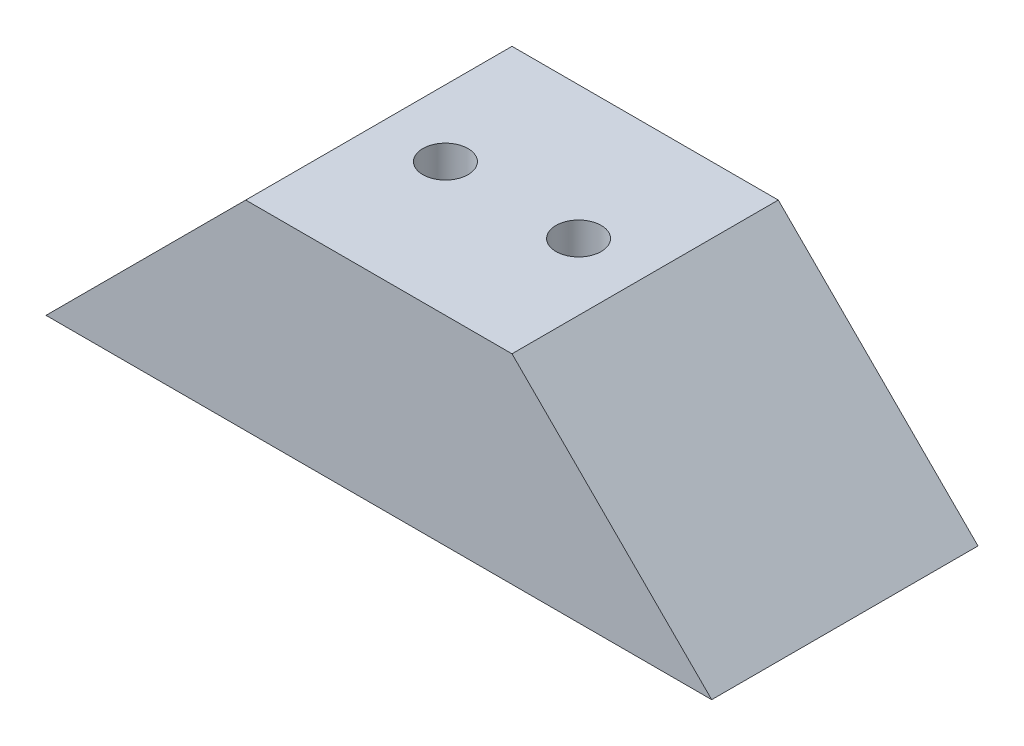
from build123d import *

# Parameters (mm, degrees)
EXTRUDE_1_DEPTH     = 20
SKETCH_2_R          = 1.7
CUT_EXTRUDE_1_DEPTH = 36.355339059


with BuildPart() as part:
    # 草图1 → 凸台-拉伸1 (new body)
    with BuildSketch(Plane.XY):
        Polygon((10, 7.5), (25, -7.5), (10, -7.5), (-10, -7.5), (-25, -7.5), (-10, 7.5), align=None)
    extrude(amount=EXTRUDE_1_DEPTH)

    # 草图2 → 切除-拉伸1 (cut, through all)
    with BuildSketch(Plane(origin=(0, 7.5, 0), x_dir=(1, 0, 0), z_dir=(0, 1, 0))):
        with Locations((-5, -10)):
            Circle(SKETCH_2_R)
        with Locations((5, -10)):
            Circle(SKETCH_2_R)
    extrude(amount=-CUT_EXTRUDE_1_DEPTH, mode=Mode.SUBTRACT)


solid = part.part
